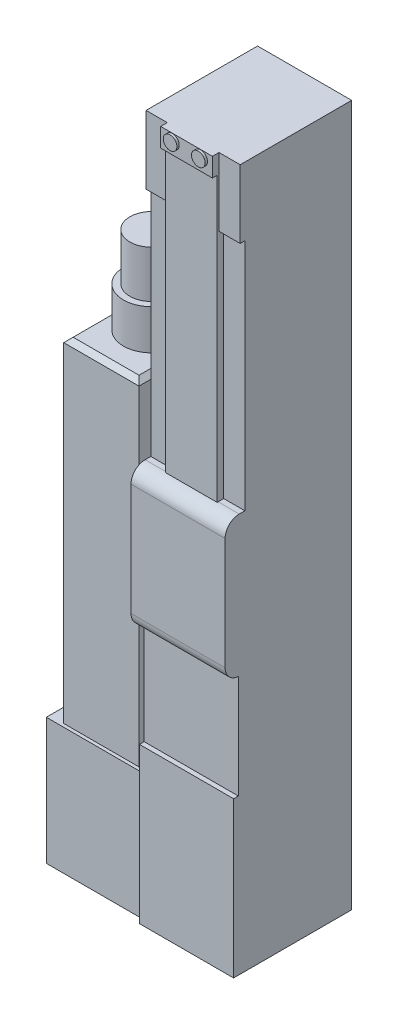
from build123d import *

# Parameters (mm, degrees)
SKETCH1_W                      = 20
SKETCH1_H                      = 149
BOSS_EXTRUDE1_DEPTH            = 26.9
SKETCH2_W                      = 21
SKETCH2_H                      = 17.5
BOSS_EXTRUDE2_DEPTH            = 26.9
SKETCH3_W                      = 16
SKETCH3_H                      = 18.9
BOSS_EXTRUDE3_DEPTH            = 71.1
SKETCH4_R                      = 6
BOSS_EXTRUDE4_DEPTH            = 8.5
SKETCH5_R                      = 4.65
BOSS_EXTRUDE5_DEPTH            = 10
SKETCH7_W                      = 20
SKETCH7_H                      = 149
CUT_EXTRUDE1_DEPTH             = 2.8
SKETCH8_W                      = 4.5
SKETCH8_H                      = 94
CUT_EXTRUDE2_DEPTH             = 1.4
SKETCH17_R                     = 1.5
CUT_EXTRUDE3_DEPTH             = 3
SKETCH9_W                      = 20
SKETCH9_H                      = 29.8
BOSS_EXTRUDE6_DEPTH            = 4.2
SKETCH12_W                     = 20
SKETCH12_H                     = 33
BOSS_EXTRUDE7_DEPTH            = 1
SKETCH14_W                     = 11
SKETCH14_H                     = 4
BOSS_EXTRUDE8_DEPTH            = 1
SKETCH15_R                     = 1.45
BOSS_EXTRUDE9_DEPTH            = 0.5
SKETCH16_W                     = 4.5
SKETCH16_H                     = 14.5
BOSS_EXTRUDE10_DEPTH           = 1
M3X0_5_TAPPED_HOLE1_AT_2_COUNT = 2
M3X0_5_TAPPED_HOLE1_AT_2_PITCH = 16
LPATTERN1_COUNT                = 3
LPATTERN1_PITCH                = 25
FILLET1_R                      = 3
CHAMFER1_SIZE                  = 1


with BuildPart() as part:
    # Sketch1 → Boss-Extrude1 (new body)
    with BuildSketch(Plane.XY):
        with Locations((0, 74.5)):
            Rectangle(SKETCH1_W, SKETCH1_H)
    extrude(amount=-BOSS_EXTRUDE1_DEPTH)

    # Sketch2 → Boss-Extrude2 (add)
    with BuildSketch(Plane.XZ):
        with Locations((-20.5, -11.75)):
            Rectangle(SKETCH2_W, SKETCH2_H)
    extrude(amount=-BOSS_EXTRUDE2_DEPTH)

    # Sketch3 → Boss-Extrude3 (add)
    with BuildSketch(Plane(origin=(0, 26.9, 0), x_dir=(1, 0, 0), z_dir=(0, 1, 0))):
        with Locations((-20, 13.15)):
            Rectangle(SKETCH3_W, SKETCH3_H)
    extrude(amount=BOSS_EXTRUDE3_DEPTH)

    # Sketch4 → Boss-Extrude4 (add)
    with BuildSketch(Plane(origin=(0, 98, 0), x_dir=(1, 0, 0), z_dir=(0, 1, 0))):
        with Locations(Location((-20, 14.4, 0), (0, 0, 180))):
            Circle(SKETCH4_R)
    extrude(amount=BOSS_EXTRUDE4_DEPTH)

    # Sketch5 → Boss-Extrude5 (add)
    with BuildSketch(Plane(origin=(0, 106.5, 0), x_dir=(1, 0, 0), z_dir=(0, 1, 0))):
        with Locations(Location((-20, 14.4, 0), (0, 0, 180))):
            Circle(SKETCH5_R)
    extrude(amount=BOSS_EXTRUDE5_DEPTH)

    # Sketch7 → Cut-Extrude1 (cut)
    with BuildSketch(Plane.XY):
        with Locations((0, 74.5)):
            Rectangle(SKETCH7_W, SKETCH7_H)
    extrude(amount=-CUT_EXTRUDE1_DEPTH, mode=Mode.SUBTRACT)

    # Sketch8 → Cut-Extrude2 (cut)
    with BuildSketch(Plane.XY.offset(-2.8)):
        with Locations((-7.75, 102)):
            Rectangle(SKETCH8_W, SKETCH8_H)
        with Locations((7.75, 102)):
            Rectangle(SKETCH8_W, SKETCH8_H)
    extrude(amount=-CUT_EXTRUDE2_DEPTH, mode=Mode.SUBTRACT)

    # Sketch17 → Cut-Extrude3 (cut)
    with BuildSketch(Plane(origin=(0, 0, -26.9), x_dir=(-1, 0, 0), z_dir=(0, 0, -1))):
        with Locations((0, 69.5)):
            Circle(SKETCH17_R)
        with BuildLine():
            Line((1.5, 120), (1.5, 119))
            ThreePointArc((1.5, 119), (0, 117.5), (-1.5, 119))
            Line((-1.5, 119), (-1.5, 120))
            ThreePointArc((-1.5, 120), (0, 121.5), (1.5, 120))
        make_face()
    extrude(amount=-CUT_EXTRUDE3_DEPTH, mode=Mode.SUBTRACT)

    # Sketch9 → Boss-Extrude6 (add)
    with BuildSketch(Plane.XY.offset(-4.2)):
        with Locations((0, 69.9)):
            Rectangle(SKETCH9_W, SKETCH9_H)
    extrude(amount=BOSS_EXTRUDE6_DEPTH)

    # Sketch12 → Boss-Extrude7 (add)
    with BuildSketch(Plane.XY.offset(-2.8)):
        with Locations((0, 16.5)):
            Rectangle(SKETCH12_W, SKETCH12_H)
    extrude(amount=BOSS_EXTRUDE7_DEPTH)

    # Sketch14 → Boss-Extrude8 (add)
    with BuildSketch(Plane.XY.offset(-2.8)):
        with Locations((0, 147)):
            Rectangle(SKETCH14_W, SKETCH14_H)
    extrude(amount=BOSS_EXTRUDE8_DEPTH)

    # Sketch15 → Boss-Extrude9 (add)
    with BuildSketch(Plane.XY.offset(-1.8)):
        with Locations((-3, 147.5)):
            Circle(SKETCH15_R)
        with Locations((3, 147.5)):
            Circle(SKETCH15_R)
    extrude(amount=BOSS_EXTRUDE9_DEPTH)

    # Sketch16 → Boss-Extrude10 (add)
    with BuildSketch(Plane.XY.offset(-4.2)):
        with Locations((-7.75, 141.75)):
            Rectangle(SKETCH16_W, SKETCH16_H)
        with Locations((7.75, 141.75)):
            Rectangle(SKETCH16_W, SKETCH16_H)
    extrude(amount=BOSS_EXTRUDE10_DEPTH)

    # Sketch10 → M3x0.5 Tapped Hole1 (revolve, cut)
    with BuildSketch(Plane(origin=(8, 69.5, -26.9), x_dir=(0, 1, 0), z_dir=(1, 0, 0))):
        Polygon((0, 0), (0, 6.251075774), (1.25, 5.5), (1.25, 0), align=None)
    m3x0_5_tapped_hole1 = revolve(axis=Axis((8, 69.5, -33.25), (0, 0, 1)), mode=Mode.SUBTRACT)

    # M3x0.5 Tapped Hole1 at 2: M3x0.5 Tapped Hole1 ×2
    with Locations(*[(-i * M3X0_5_TAPPED_HOLE1_AT_2_PITCH, 0, 0) for i in range(1, M3X0_5_TAPPED_HOLE1_AT_2_COUNT)]):
        add(m3x0_5_tapped_hole1, mode=Mode.SUBTRACT)

    # LPattern1: M3x0.5 Tapped Hole1 ×3
    with Locations(*[(0, i * LPATTERN1_PITCH, 0) for i in range(1, LPATTERN1_COUNT)]):
        add(m3x0_5_tapped_hole1, mode=Mode.SUBTRACT)

    # LPattern1 copy 1 sketch → LPattern1 copy 1 (revolve, cut)
    with BuildSketch(Plane(origin=(-8, 94.5, -26.9), x_dir=(0, 1, 0), z_dir=(1, 0, 0))):
        Polygon((0, 0), (0, 6.251075774), (1.25, 5.5), (1.25, 0), align=None)
    revolve(axis=Axis((-8, 94.5, -33.25), (0, 0, 1)), mode=Mode.SUBTRACT)

    # LPattern1 copy 2 sketch → LPattern1 copy 2 (revolve, cut)
    with BuildSketch(Plane(origin=(-8, 119.5, -26.9), x_dir=(0, 1, 0), z_dir=(1, 0, 0))):
        Polygon((0, 0), (0, 6.251075774), (1.25, 5.5), (1.25, 0), align=None)
    revolve(axis=Axis((-8, 119.5, -33.25), (0, 0, 1)), mode=Mode.SUBTRACT)

    # Fillet1
    # the kernel refuses this fillet: 3 mm, written as the material it takes off along each edge
    with BuildSketch(Plane(origin=(-17.483314774, 55, 0), x_dir=(0, 1, 0), z_dir=(1, 0, 0))) as fillet1_piece_1:
        with BuildLine():
            CenterArc((2.993325909, -3), FILLET1_R, 90, 86.177446271)
            Line((0, -2.8), (0, 0))
            Line((0, 0), (2.993325909, 0))
        make_face()
    extrude(amount=34.966629547, mode=Mode.SUBTRACT)
    with BuildSketch(Plane(origin=(17.5, 84.8, 0), x_dir=(0, 0, -1), z_dir=(-1, 0, 0))) as fillet1_piece_2_section:
        with BuildLine():
            CenterArc((FILLET1_R, FILLET1_R), FILLET1_R, 180, 90)
            Line((0, FILLET1_R), (0, 0))
            Line((0, 0), (FILLET1_R, 0))
        make_face()
    fillet1_piece_2 = extrude(amount=35, mode=Mode.PRIVATE)
    fillet1_piece_2 = split(fillet1_piece_2, bisect_by=Plane(origin=(5.5, 84.8, 0), z_dir=(1, 0, 0)), keep=Keep.TOP, mode=Mode.PRIVATE)
    add(fillet1_piece_2, mode=Mode.SUBTRACT)
    with BuildSketch(Plane(origin=(17.5, 84.8, 0), x_dir=(0, 0, -1), z_dir=(-1, 0, 0))) as fillet1_piece_3_section:
        with BuildLine():
            CenterArc((FILLET1_R, FILLET1_R), FILLET1_R, 180, 90)
            Line((0, FILLET1_R), (0, 0))
            Line((0, 0), (FILLET1_R, 0))
        make_face()
    fillet1_piece_3 = extrude(amount=35, mode=Mode.PRIVATE)
    fillet1_piece_3 = split(fillet1_piece_3, bisect_by=Plane(origin=(17.5, 84.8, -2.8), z_dir=(0, 0, 1)), keep=Keep.TOP, mode=Mode.PRIVATE)
    add(fillet1_piece_3, mode=Mode.SUBTRACT)
    with BuildSketch(Plane(origin=(17.5, 84.8, 0), x_dir=(0, 0, -1), z_dir=(-1, 0, 0))) as fillet1_piece_4_section:
        with BuildLine():
            CenterArc((FILLET1_R, FILLET1_R), FILLET1_R, 180, 90)
            Line((0, FILLET1_R), (0, 0))
            Line((0, 0), (FILLET1_R, 0))
        make_face()
    fillet1_piece_4 = extrude(amount=35, mode=Mode.PRIVATE)
    fillet1_piece_4 = split(fillet1_piece_4, bisect_by=Plane(origin=(-5.5, 84.8, 0), z_dir=(-1, 0, 0)), keep=Keep.TOP, mode=Mode.PRIVATE)
    add(fillet1_piece_4, mode=Mode.SUBTRACT)

    # Chamfer1
    chamfer1_edges = [part.edges().sort_by_distance(p)[0] for p in [
        (-28, 98, -13.15),
        (-20, 98, -3.7),
        (-12, 98, -13.15),
        (-20, 98, -22.6),
    ]]
    chamfer(chamfer1_edges, length=CHAMFER1_SIZE)


solid = part.part
